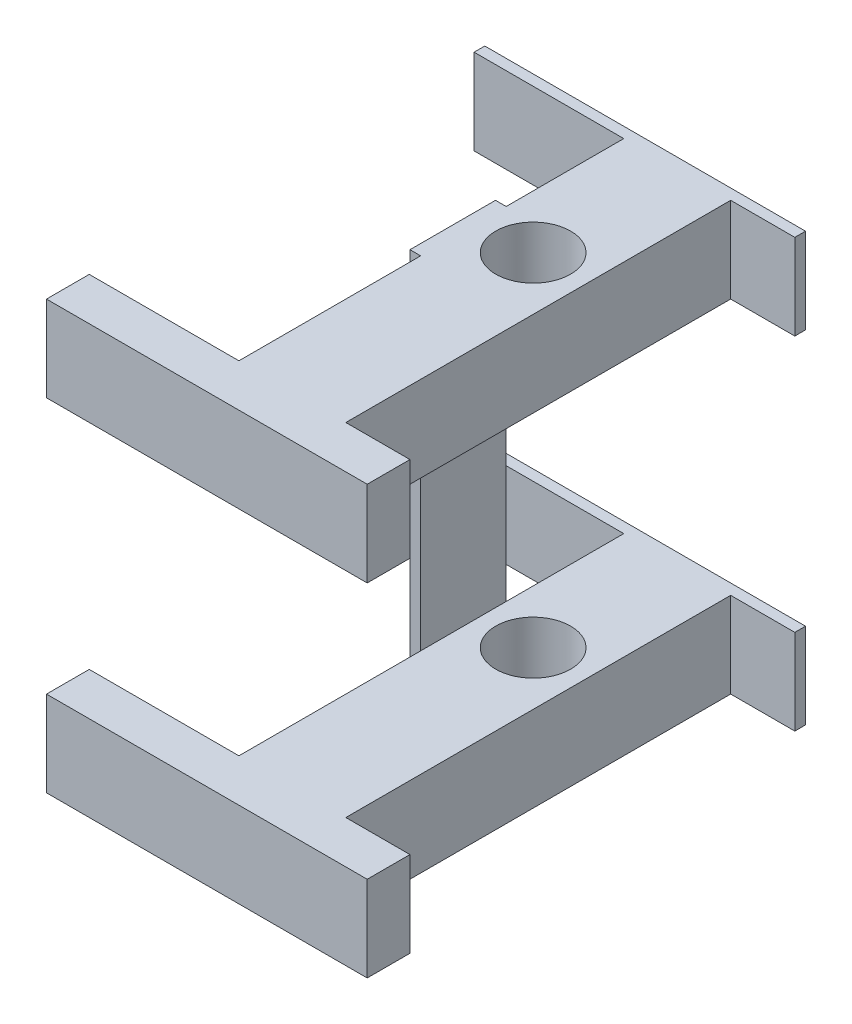
from build123d import *

# Parameters (mm, degrees)
SKETCH1_W           = 190.5
SKETCH1_H           = 50.8
BOSS_EXTRUDE1_DEPTH = 25.4
SKETCH2_W           = 63.5
SKETCH2_H           = 228.6
BOSS_EXTRUDE2_DEPTH = 50.8
SKETCH3_W           = 190.5
SKETCH3_H           = 50.8
BOSS_EXTRUDE3_DEPTH = 6.35
SKETCH4_R           = 22.225
CUT_EXTRUDE1_DEPTH  = 307.712230764
SKETCH5_W           = 50.8
SKETCH5_H           = 254
BOSS_EXTRUDE4_DEPTH = 6.35
LPATTERN2_START     = 203.2
LPATTERN2_OUTLINE_R = 22.225
LPATTERN2_DEPTH     = 50.8
SKETCH6_W           = 190.5
SKETCH6_H           = 50.8
BOSS_EXTRUDE5_DEPTH = 25.4


# Read off the part's stored shape, not the designer's step: LPattern2
with BuildPart() as part:
    # Sketch1 → Boss-Extrude1 (new body)
    with BuildSketch(Plane.XY):
        with Locations((95.25, 25.4)):
            Rectangle(SKETCH1_W, SKETCH1_H)
    extrude(amount=BOSS_EXTRUDE1_DEPTH)

    # Sketch2 → Boss-Extrude2 (add)
    with BuildSketch(Plane.XZ):
        with Locations((120.65, -114.3)):
            Rectangle(SKETCH2_W, SKETCH2_H)
    extrude(amount=-BOSS_EXTRUDE2_DEPTH)

    # Sketch3 → Boss-Extrude3 (add)
    with BuildSketch(Plane(origin=(0, 0, -228.6), x_dir=(-1, 0, 0), z_dir=(0, 0, -1))):
        with Locations((-95.25, 25.4)):
            Rectangle(SKETCH3_W, SKETCH3_H)
    extrude(amount=BOSS_EXTRUDE3_DEPTH)

    # Sketch4 → Cut-Extrude1 (cut, through all)
    with BuildSketch(Plane.XZ):
        with Locations(Location((120.65, -143.027799697, 0), (0, 0, 270))):
            Circle(SKETCH4_R)
    extrude(amount=-CUT_EXTRUDE1_DEPTH, mode=Mode.SUBTRACT)

    # Sketch5 → Boss-Extrude4 (add)
    with BuildSketch(Plane.ZY.offset(-88.9)):
        with Locations((-133.35, 127)):
            Rectangle(SKETCH5_W, SKETCH5_H)
    extrude(amount=BOSS_EXTRUDE4_DEPTH)

    # LPattern2 outline → LPattern2 (add)
    with BuildSketch(Plane(origin=(0, 0, 0), x_dir=(1, 0, 0), z_dir=(0, 1, 0)).offset(LPATTERN2_START)):
        Polygon((88.9, 228.6), (88.9, 0), (152.4, 0), (152.4, 228.6), (190.5, 228.6), (190.5, 234.95), (0, 234.95), (0, 228.6), align=None)
        with Locations((120.65, 143.027799697)):
            Circle(LPATTERN2_OUTLINE_R, mode=Mode.SUBTRACT)
    extrude(amount=LPATTERN2_DEPTH)

    # Sketch6 → Boss-Extrude5 (add)
    with BuildSketch(Plane.XY):
        with Locations((95.25, 228.6)):
            Rectangle(SKETCH6_W, SKETCH6_H)
    extrude(amount=BOSS_EXTRUDE5_DEPTH)


solid = part.part
